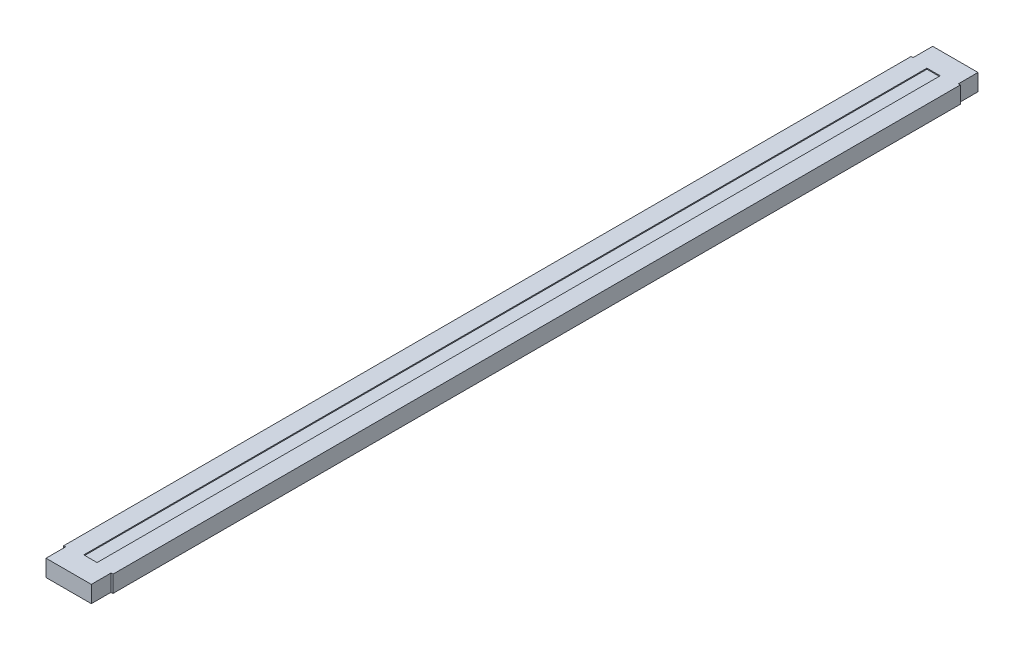
from build123d import *

# Parameters (mm, degrees)
SKETCH1_W               = 12.7
SKETCH1_H               = 4.318
BOSS_EXTRUDE1_DEPTH     = 228.6
SKETCH2_W               = 3.429
SKETCH2_H               = 217.3732
CUT_EXTRUDE1_DEPTH      = 0.254
SKETCH3_W               = 0.508
SKETCH3_H               = 5.08
CUT_EXTRUDE2_DEPTH      = 229.728939192
MIRROR2_COPY_1_SKETCH_W = 0.508
MIRROR2_COPY_1_SKETCH_H = 5.08
MIRROR2_COPY_1_DEPTH    = 229.728939192


with BuildPart() as part:
    # Sketch1 → Boss-Extrude1 (new body)
    with BuildSketch(Plane.XY):
        Rectangle(SKETCH1_W, SKETCH1_H)
    extrude(amount=BOSS_EXTRUDE1_DEPTH)

    # Sketch2 → Cut-Extrude1 (cut)
    with BuildSketch(Plane(origin=(0, 2.159, 0), x_dir=(1, 0, 0), z_dir=(0, 1, 0))):
        with Locations((0, -114.3)):
            Rectangle(SKETCH2_W, SKETCH2_H)
    extrude(amount=-CUT_EXTRUDE1_DEPTH, mode=Mode.SUBTRACT)

    # Sketch3 → Cut-Extrude2 (cut, through all)
    with BuildSketch(Plane(origin=(0, 2.159, 0), x_dir=(1, 0, 0), z_dir=(0, 1, 0))):
        with Locations((-6.096, -226.06)):
            Rectangle(SKETCH3_W, SKETCH3_H)
    cut_extrude2 = extrude(amount=-CUT_EXTRUDE2_DEPTH, mode=Mode.SUBTRACT)

    # Mirror1: Cut-Extrude2 across plane
    add(cut_extrude2.mirror(Plane(origin=(0, 0, 114.3), x_dir=(1, 0, 0), z_dir=(0, 0, -1))), mode=Mode.SUBTRACT)

    # Mirror2: Cut-Extrude2 across plane
    add(cut_extrude2.mirror(Plane(origin=(0, 0, 0), x_dir=(0, 0, 1), z_dir=(1, 0, 0))), mode=Mode.SUBTRACT)

    # Mirror2 copy 1 sketch → Mirror2 copy 1 (cut, through all)
    with BuildSketch(Plane(origin=(0, 2.159, 228.6), x_dir=(-1, 0, 0), z_dir=(0, 1, 0))):
        with Locations((-6.096, -226.06)):
            Rectangle(MIRROR2_COPY_1_SKETCH_W, MIRROR2_COPY_1_SKETCH_H)
    extrude(amount=-MIRROR2_COPY_1_DEPTH, mode=Mode.SUBTRACT)


solid = part.part
